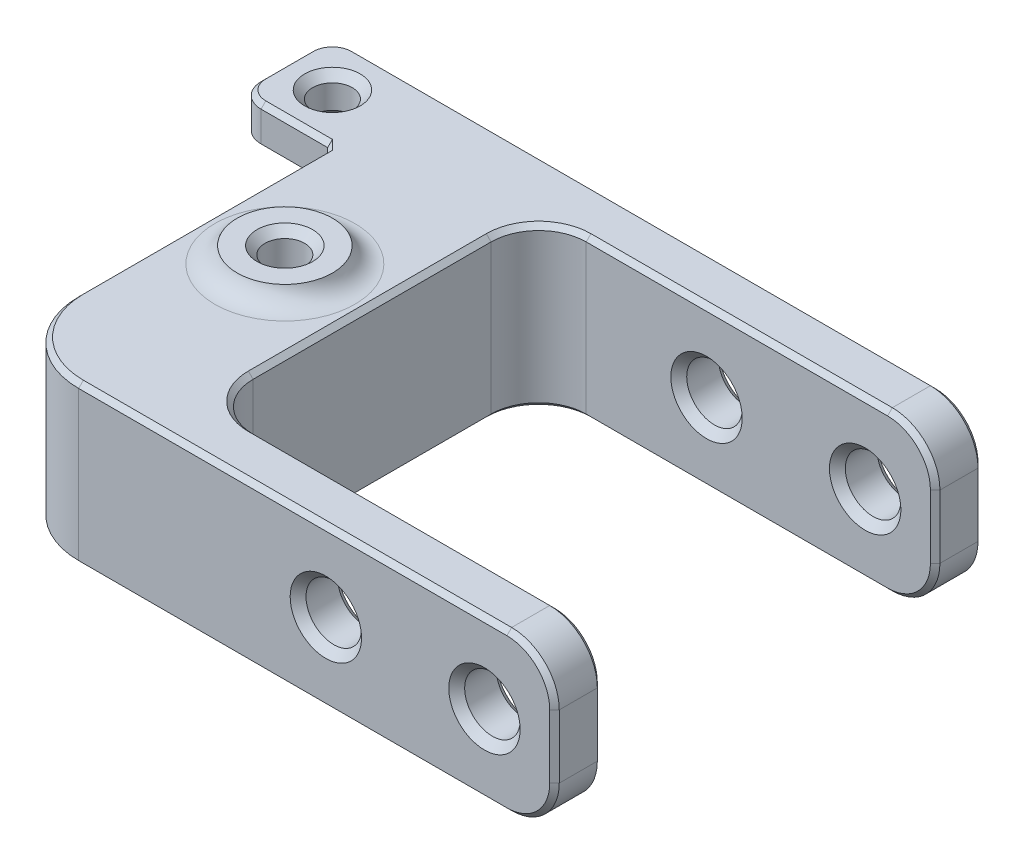
from build123d import *

# Parameters (mm, degrees)
EXTRUDE_1_DEPTH     = 10
SKETCH_2_R          = 1.75
CUT_EXTRUDE_1_DEPTH = 28
SKETCH_3_W          = 6
SKETCH_3_H          = 5.152186346
CUT_EXTRUDE_2_DEPTH = 8
SKETCH_4_R          = 1.25
CUT_EXTRUDE_3_DEPTH = 11
FILLET_1_R          = 3
FILLET_2_R          = 5
FILLET_3_R          = 1.5
SKETCH_5_R          = 3
EXTRUDE_2_DEPTH     = 1
EXTRUDE_START       = 1
SKETCH_6_R          = 3
EXTRUDE_3_DEPTH     = 1
FILLET_4_R          = 1.5
SKETCH_7_R          = 1.25
CUT_EXTRUDE_4_DEPTH = 17
CHAMFER_1_SIZE      = 0.5
FILLET_5_R          = 3
CHAMFER_2_SIZE      = 0.3


with BuildPart() as part:
    # 草图1 → 凸台-拉伸1 (new body)
    with BuildSketch(Plane(origin=(0, 0, 0), x_dir=(1, 0, 0), z_dir=(0, 1, 0))):
        Polygon((23.273216446, 11.883138654), (23.273216446, 8.883138654), (-1.726783554, 8.883138654), (-1.726783554, -12.116861346), (23.273216446, -12.116861346), (23.273216446, -15.116861346), (-11.726783554, -15.116861346), (-11.726783554, 5.883138654), (-17.726783554, 5.883138654), (-17.726783554, 11.883138654), (-11.726783554, 11.883138654), align=None)
    extrude(amount=EXTRUDE_1_DEPTH)

    # 草图2 → 切除-拉伸1 (cut)
    with BuildSketch(Plane(origin=(0, 0, -11.883138654), x_dir=(-1, 0, 0), z_dir=(0, 0, -1))):
        with Locations((-18.858625261, 5)):
            Circle(SKETCH_2_R)
        with Locations((-8.858625261, 5)):
            Circle(SKETCH_2_R)
    extrude(amount=-CUT_EXTRUDE_1_DEPTH, mode=Mode.SUBTRACT)

    # 草图3 → 切除-拉伸2 (cut)
    with BuildSketch(Plane.XY.offset(-5.883138654)):
        with Locations((-14.726783554, 4.923906827)):
            Rectangle(SKETCH_3_W, SKETCH_3_H)
    extrude(amount=-CUT_EXTRUDE_2_DEPTH, mode=Mode.SUBTRACT)

    # 草图4 → 切除-拉伸3 (cut)
    with BuildSketch(Plane(origin=(0, 10, 0), x_dir=(1, 0, 0), z_dir=(0, 1, 0))):
        with Locations(Location((-14.726783554, 8.883138654, 0), (0, 0, 270))):
            Circle(SKETCH_4_R)
    extrude(amount=-CUT_EXTRUDE_3_DEPTH, mode=Mode.SUBTRACT)

    # 圆角1
    fillet_1_edges = [part.edges().sort_by_distance(p)[0] for p in [
        (23.273216446, 0, -10.383138654),
        (23.273216446, 0, 13.616861346),
        (23.273216446, 10, 13.616861346),
        (23.273216446, 10, -10.383138654),
    ]]
    fillet(fillet_1_edges, radius=FILLET_1_R)

    # 圆角2
    fillet_2_edges = [part.edges().sort_by_distance(p)[0] for p in [
        (-11.726783554, 5, 15.116861346),
    ]]
    fillet(fillet_2_edges, radius=FILLET_2_R)

    # 圆角3
    fillet_3_edges = [part.edges().sort_by_distance(p)[0] for p in [
        (-17.726783554, 8.75, -5.883138654),
        (-17.726783554, 8.75, -11.883138654),
        (-17.726783554, 1.173906827, -11.883138654),
        (-17.726783554, 1.173906827, -5.883138654),
    ]]
    fillet(fillet_3_edges, radius=FILLET_3_R)

    # 草图5 → 凸台-拉伸2 (add)
    with BuildSketch(Plane.XZ):
        with Locations(Location((-6.726783554, 2.116861346, 0), (0, 0, 90))):
            Circle(SKETCH_5_R)
    extrude(amount=EXTRUDE_2_DEPTH)

    # 草图6 → 凸台-拉伸3 (add)
    with BuildSketch(Plane(origin=(0, 10, 0), x_dir=(1, 0, 0), z_dir=(0, 1, 0)).offset(EXTRUDE_START)):
        with Locations(Location((-6.726783554, -2.116861346, 0), (0, 0, 270))):
            Circle(SKETCH_6_R)
    extrude(amount=-EXTRUDE_3_DEPTH)

    # 圆角4
    # the kernel refuses this fillet: 1.5 mm, written as the material it adds along each edge
    with BuildSketch(Plane(origin=(-6.726783554, 0, 2.116861346), x_dir=(0, 0, 1), z_dir=(1, 0, 0))) as fillet_4_piece_1:
        with BuildLine():
            CenterArc((4.414213562, 1.5), FILLET_4_R, 199.471220634, 70.528779366)
            Line((3, 1), (2.971715729, 0.99))
            ThreePointArc((2.971715729, 0.99), (2.97, 0.5), (2.97, 0))
            Line((2.97, 0), (3, -0.03))
            Line((3, -0.03), (4.414213562, -0.03))
            Line((4.414213562, -0.03), (4.414213562, 0))
        make_face()
    revolve(axis=Axis((-6.726783554, 0, 2.116861346), (0, -1, 0)))
    with BuildSketch(Plane(origin=(-6.726783554, 10, 2.116861346), x_dir=(0, 0, 1), z_dir=(-1, 0, 0))) as fillet_4_piece_2:
        with BuildLine():
            CenterArc((4.414213562, 1.5), FILLET_4_R, 199.471220634, 70.528779366)
            Line((3, 1), (2.971715729, 0.99))
            ThreePointArc((2.971715729, 0.99), (2.97, 0.5), (2.97, 0))
            Line((2.97, 0), (3, -0.03))
            Line((3, -0.03), (4.414213562, -0.03))
            Line((4.414213562, -0.03), (4.414213562, 0))
        make_face()
    revolve(axis=Axis((-6.726783554, 10, 2.116861346), (0, 1, 0)))

    # 草图7 → 切除-拉伸4 (cut)
    with BuildSketch(Plane.XZ.offset(1)):
        with Locations(Location((-6.726783554, 2.116861346, 0), (0, 0, 270))):
            Circle(SKETCH_7_R)
    extrude(amount=-CUT_EXTRUDE_4_DEPTH, mode=Mode.SUBTRACT)

    # 倒角1
    chamfer_1_edges = [part.edges().sort_by_distance(p)[0] for p in [
        (-6.726783554, 11, 3.366861346),
        (-6.726783554, -1, 3.366861346),
        (20.608625261, 5, 12.116861346),
        (20.608625261, 5, 15.116861346),
        (20.608625261, 5, -8.883138654),
        (20.608625261, 5, -11.883138654),
        (10.608625261, 5, 12.116861346),
        (10.608625261, 5, 15.116861346),
        (10.608625261, 5, -8.883138654),
        (10.608625261, 5, -11.883138654),
        (-14.726783554, 2.347813654, -10.133138654),
        (-14.726783554, 0, -10.133138654),
        (-14.726783554, 7.5, -10.133138654),
        (-14.726783554, 10, -10.133138654),
    ]]
    chamfer(chamfer_1_edges, length=CHAMFER_1_SIZE)

    # 圆角5
    fillet_5_edges = [part.edges().sort_by_distance(p)[0] for p in [
        (-1.726783554, 5, -8.883138654),
        (-1.726783554, 5, 12.116861346),
    ]]
    fillet(fillet_5_edges, radius=FILLET_5_R)

    # 倒角2
    chamfer_2_edges = [part.edges().sort_by_distance(p)[0] for p in [
        (6.773216446, 0, 15.116861346),
        (6.773216446, 10, 15.116861346),
        (-10.26231746, 0, 13.652395252),
        (-10.26231746, 10, 13.652395252),
        (-13.976783554, 10, -5.883138654),
        (-17.726783554, 7.5, -8.883138654),
        (-17.287443726, 7.5, -11.443798826),
        (-17.287443726, 7.5, -6.322478482),
        (-17.726783554, 10, -8.883138654),
        (-17.287443726, 10, -11.443798826),
        (-17.287443726, 10, -6.322478482),
        (-13.976783554, 2.347813654, -5.883138654),
        (-13.976783554, 0, -5.883138654),
        (-17.726783554, 0, -8.883138654),
        (-17.287443726, 0, -11.443798826),
        (-17.287443726, 0, -6.322478482),
        (-17.726783554, 2.347813654, -8.883138654),
        (-13.976783554, 2.347813654, -11.883138654),
        (-17.287443726, 2.347813654, -11.443798826),
        (-17.287443726, 2.347813654, -6.322478482),
        (-11.726783554, 0, 2.116861346),
        (-11.726783554, 10, 2.116861346),
        (-11.726783554, 8.75, -5.883138654),
        (10.773216446, 0, -8.883138654),
        (10.773216446, 10, -8.883138654),
        (-1.726783554, 0, 1.616861346),
        (-1.726783554, 10, 1.616861346),
        (-0.848103898, 0, -8.004458997),
        (-0.848103898, 10, -8.004458997),
        (-0.848103898, 0, 11.23818169),
        (-0.848103898, 10, 11.23818169),
        (-11.726783554, 4.923906827, -11.883138654),
        (-13.976783554, 7.5, -11.883138654),
        (-11.726783554, 1.173906827, -5.883138654),
        (-11.726783554, 7.5, -8.883138654),
        (-11.726783554, 2.347813654, -8.883138654),
        (-13.976783554, 7.5, -5.883138654),
        (23.273216446, 5, 12.116861346),
        (23.273216446, 5, 15.116861346),
        (10.773216446, 0, 12.116861346),
        (10.773216446, 10, 12.116861346),
        (22.394536789, 9.121320344, 12.116861346),
        (22.394536789, 0.878679656, 12.116861346),
        (2.023216446, 0, -11.883138654),
        (22.394536789, 9.121320344, 15.116861346),
        (22.394536789, 0.878679656, 15.116861346),
        (2.023216446, 10, -11.883138654),
        (23.273216446, 5, -11.883138654),
        (23.273216446, 5, -8.883138654),
        (22.394536789, 9.121320344, -11.883138654),
        (22.394536789, 0.878679656, -11.883138654),
        (22.394536789, 9.121320344, -8.883138654),
        (22.394536789, 0.878679656, -8.883138654),
    ]]
    chamfer(chamfer_2_edges, length=CHAMFER_2_SIZE)


solid = part.part
